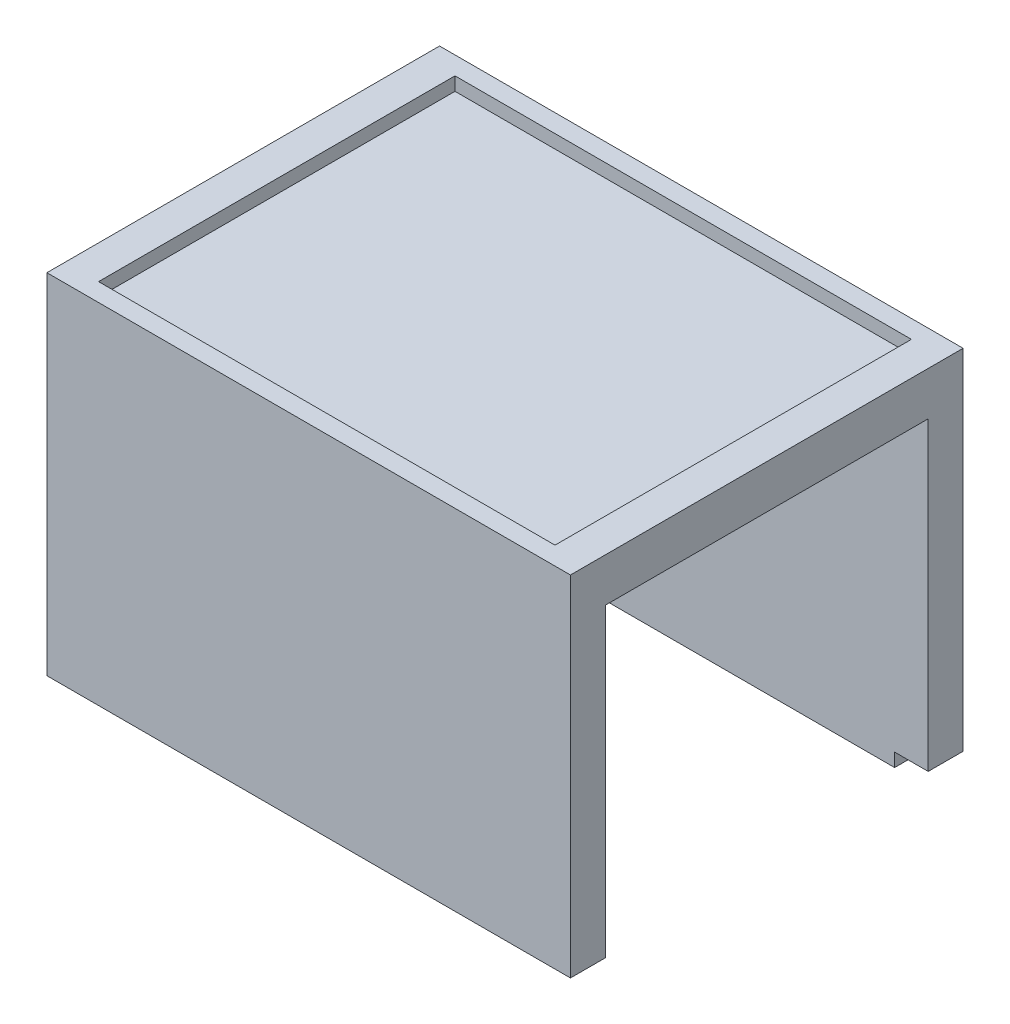
from build123d import *

# Parameters (mm, degrees)
SKETCH1_W           = 39
SKETCH1_H           = 29.25
BOSS_EXTRUDE1_DEPTH = 3.25
SKETCH2_W           = 34
SKETCH2_H           = 24
CUT_EXTRUDE1_DEPTH  = 1
SKETCH3_W           = 34
SKETCH3_H           = 1.275
CUT_EXTRUDE2_DEPTH  = 1
SKETCH4_W           = 39
SKETCH4_H           = 22.75
BOSS_EXTRUDE2_DEPTH = 2.6
SKETCH6_W           = 34
SKETCH6_H           = 1.25
BOSS_EXTRUDE3_DEPTH = 1


with BuildPart() as part:
    # Sketch1 → Boss-Extrude1 (new body)
    with BuildSketch(Plane(origin=(0, 0, 0), x_dir=(1, 0, 0), z_dir=(0, 1, 0))):
        Rectangle(SKETCH1_W, SKETCH1_H)
    extrude(amount=BOSS_EXTRUDE1_DEPTH)

    # Sketch2 → Cut-Extrude1 (cut)
    with BuildSketch(Plane(origin=(0, 3.25, 0), x_dir=(1, 0, 0), z_dir=(0, 1, 0))):
        Rectangle(SKETCH2_W, SKETCH2_H)
    extrude(amount=-CUT_EXTRUDE1_DEPTH, mode=Mode.SUBTRACT)

    # Sketch3 → Cut-Extrude2 (cut)
    with BuildSketch(Plane(origin=(0, 3.25, 0), x_dir=(1, 0, 0), z_dir=(0, 1, 0))):
        with Locations((0, -12.6375)):
            Rectangle(SKETCH3_W, SKETCH3_H)
    cut_extrude2 = extrude(amount=-CUT_EXTRUDE2_DEPTH, mode=Mode.SUBTRACT)

    # Mirror1: Cut-Extrude2 across plane
    add(cut_extrude2.mirror(Plane.XY), mode=Mode.SUBTRACT)

    # Sketch4 → Boss-Extrude2 (add)
    with BuildSketch(Plane.XY.offset(14.625)):
        with Locations((0, -11.375)):
            Rectangle(SKETCH4_W, SKETCH4_H)
    boss_extrude2 = extrude(amount=-BOSS_EXTRUDE2_DEPTH)

    # Sketch6 → Boss-Extrude3 (add)
    with BuildSketch(Plane.XZ.offset(22.75)):
        with Locations((0, 12.65)):
            Rectangle(SKETCH6_W, SKETCH6_H)
    boss_extrude3 = extrude(amount=BOSS_EXTRUDE3_DEPTH)

    # Mirror2: Boss-Extrude2, Boss-Extrude3 across plane
    add(boss_extrude2.mirror(Plane.XY))
    add(boss_extrude3.mirror(Plane.XY))


solid = part.part
